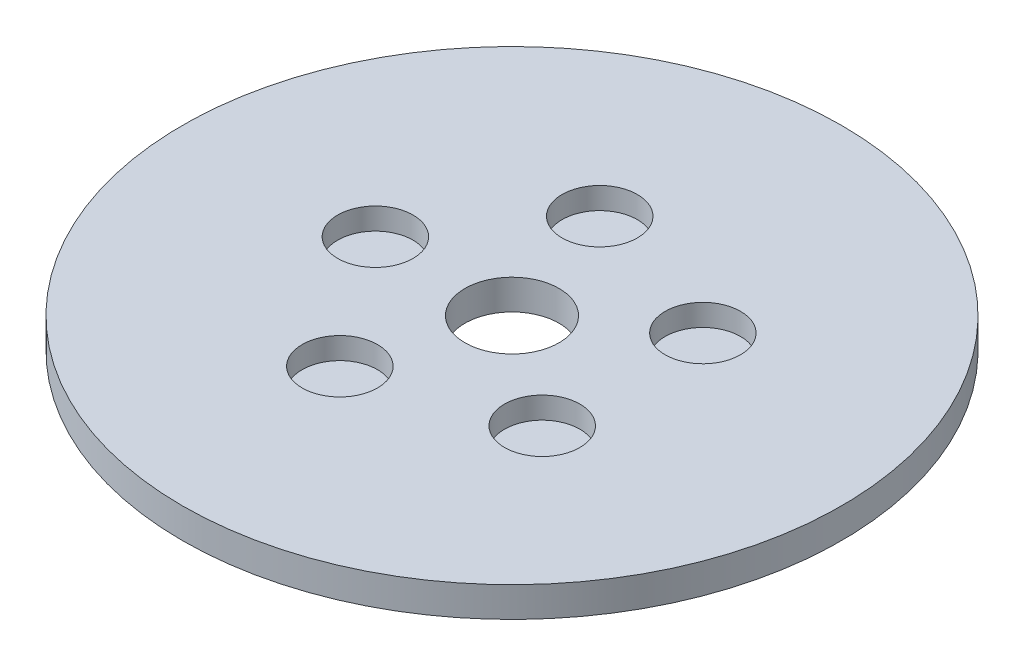
from build123d import *

# Parameters (mm, degrees)
SKETCH1_R           = 87.5
BOSS_EXTRUDE1_DEPTH = 8
SKETCH2_R           = 12.5
CUT_EXTRUDE1_DEPTH  = 125.002016113
SKETCH3_R           = 10
CUT_EXTRUDE2_DEPTH  = 5.78086032
CIRPATTERN1_COUNT   = 5


with BuildPart() as part:
    # Sketch1 → Boss-Extrude1 (new body)
    with BuildSketch(Plane(origin=(0, 0, 0), x_dir=(1, 0, 0), z_dir=(0, 1, 0))):
        Circle(SKETCH1_R)
    extrude(amount=BOSS_EXTRUDE1_DEPTH)

    # Sketch2 → Cut-Extrude1 (cut, through all)
    with BuildSketch(Plane(origin=(0, 0, 0), x_dir=(1, 0, 0), z_dir=(0, 1, 0))):
        Circle(SKETCH2_R)
    extrude(amount=CUT_EXTRUDE1_DEPTH, mode=Mode.SUBTRACT)

    # Sketch3 → Cut-Extrude2 (cut)
    with BuildSketch(Plane(origin=(0, 8, 0), x_dir=(1, 0, 0), z_dir=(0, 1, 0))):
        with Locations((-36.274627371, 0)):
            Circle(SKETCH3_R)
    cut_extrude2 = extrude(amount=-CUT_EXTRUDE2_DEPTH, mode=Mode.SUBTRACT)

    # CirPattern1: Cut-Extrude2 ×5 about axis
    cirpattern1_axis = Axis((0, 0, 0), (0, 1, 0))
    for i in range(1, CIRPATTERN1_COUNT):
        add(cut_extrude2.rotate(cirpattern1_axis, i * 360 / CIRPATTERN1_COUNT), mode=Mode.SUBTRACT)


solid = part.part
